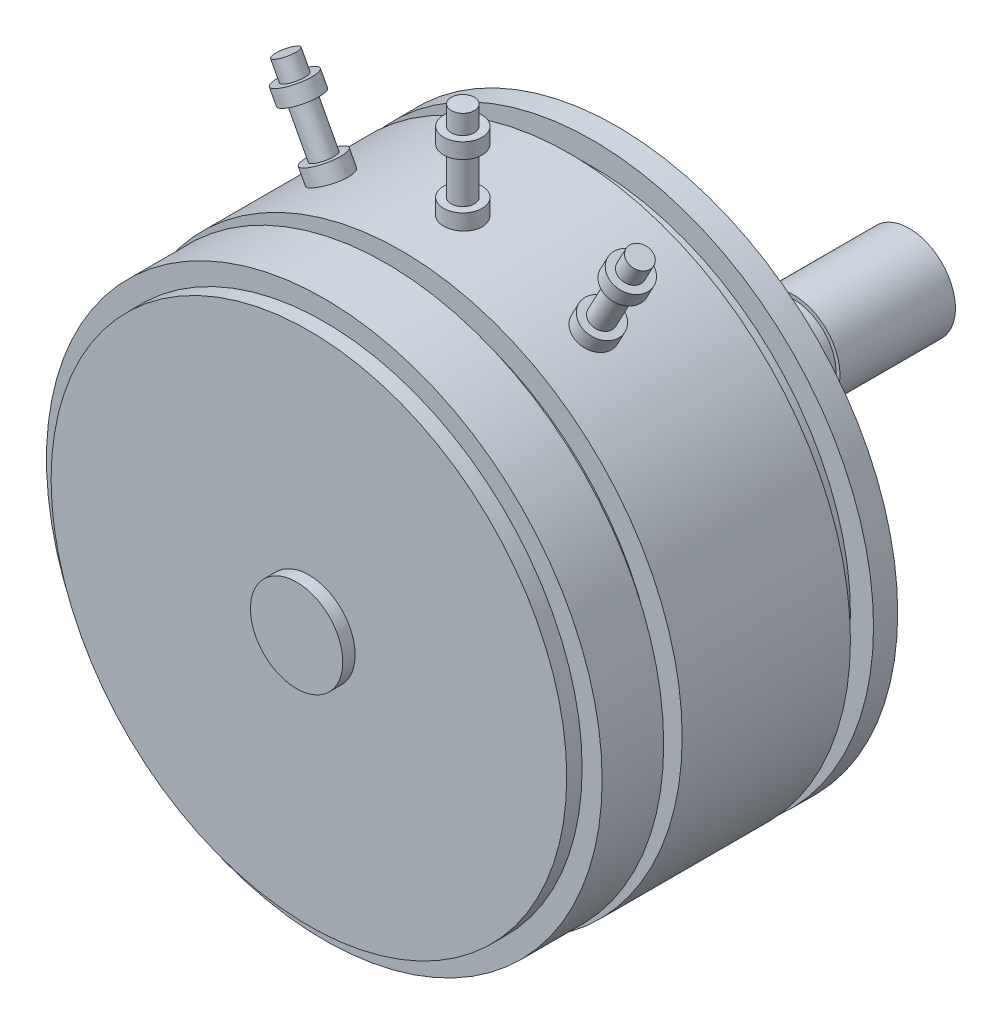
from build123d import *

# Parameters (mm, degrees)
SKETCH_5_R                 = 3
SKETCH_5_R_2               = 2.75
EXTRUDE_3_DEPTH            = 19
SKETCH_5_3_R               = 10
SKETCH_5_3_R_2             = 3
EXTRUDE_4_DEPTH            = 1.6
CUT_EXTRUDE_START          = 6.5
SKETCH_5_4_R               = 3
SKETCH_5_4_R_2             = 2.75
CUT_EXTRUDE_5_DEPTH        = 5
SKETCH_6_R                 = 0.75
EXTRUDE_5_DEPTH            = 24.5
EXTRUDE_START              = 18.207141
SKETCH_6_4_R               = 1.25
SKETCH_6_4_R_2             = 0.75
EXTRUDE_10_DEPTH           = 5.042859
SKETCH_6_5_R               = 1.25
SKETCH_6_5_R_2             = 0.75
CUT_EXTRUDE_6_DEPTH        = 22.25
SKETCH_6_6_R               = 1.25
SKETCH_6_6_R_2             = 0.75
EXTRUDE_11_DEPTH           = 19.25
PATTERN_CIRCULAR_1_ANGLE   = 28
PATTERN_CIRCULAR_1_2_ANGLE = 28
SKETCH_7_R                 = 1.5
CUT_EXTRUDE_7_DEPTH        = 3
EXTRUDE_START_2            = 0.8
SKETCH_8_R                 = 3
EXTRUDE_12_DEPTH           = 0.8


with BuildPart() as part:
    # 草图4 → 旋转1 (revolve)
    with BuildSketch(Plane(origin=(0, 0, 0), x_dir=(0, 0, -1), z_dir=(1, 0, 0)), mode=Mode.PRIVATE) as revolve_1_sk:
        Polygon((0, 0), (0, 16.75), (1, 16.75), (1, 18.05), (5, 18.05), (5, 16.75), (6, 16.75), (6, 18.25), (16.93, 18.25), (16.93, 16.75), (18.43, 16.75), (18.43, 18.25), (20, 18.25), (20, 0), align=None)
    revolve(revolve_1_sk.sketch.rotate(Axis((0, 0, 42.478286457), (0, 0, -1)), 90), axis=Axis((0, 0, 42.478286457), (0, 0, -1)))

    # 草图5 → 凸台-拉伸3 (add)
    # profile 1 of 2: a face of its own
    with BuildSketch(Plane(origin=(0, 0, -20), x_dir=(-1, 0, 0), z_dir=(0, 0, -1))):
        Circle(SKETCH_5_R)
        Circle(SKETCH_5_R_2, mode=Mode.SUBTRACT)
    # profile 2 of 2: a face of its own
    with BuildSketch(Plane(origin=(0, 0, -20), x_dir=(-1, 0, 0), z_dir=(0, 0, -1))):
        Circle(SKETCH_5_R_2)
    extrude(amount=EXTRUDE_3_DEPTH)

    # 草图5<3> → 凸台-拉伸4 (add)
    with BuildSketch(Plane(origin=(0, 0, -20), x_dir=(-1, 0, 0), z_dir=(0, 0, -1))):
        Circle(SKETCH_5_3_R)
        Circle(SKETCH_5_3_R_2, mode=Mode.SUBTRACT)
    extrude(amount=EXTRUDE_4_DEPTH)

    # 草图5<4> → 切除-拉伸5 (cut)
    with BuildSketch(Plane(origin=(0, 0, -20), x_dir=(-1, 0, 0), z_dir=(0, 0, -1)).offset(CUT_EXTRUDE_START)):
        Circle(SKETCH_5_4_R)
        Circle(SKETCH_5_4_R_2, mode=Mode.SUBTRACT)
    extrude(amount=CUT_EXTRUDE_5_DEPTH, mode=Mode.SUBTRACT)

    # 草图6 → 凸台-拉伸5 (add)
    with BuildSketch(Plane(origin=(0, 0, 0), x_dir=(1, 0, 0), z_dir=(0, 1, 0))):
        with Locations(Location((0, 10, 0), (0, 0, 90))):
            Circle(SKETCH_6_R)
    extrude(amount=EXTRUDE_5_DEPTH)

    # 草图6<4> → 凸台-拉伸10 (add)
    with BuildSketch(Plane(origin=(0, 0, 0), x_dir=(1, 0, 0), z_dir=(0, 1, 0)).offset(EXTRUDE_START)):
        with Locations(Location((0, 10, 0), (0, 0, 90))):
            Circle(SKETCH_6_4_R)
        with Locations(Location((0, 10, 0), (0, 0, 270))):
            Circle(SKETCH_6_4_R_2, mode=Mode.SUBTRACT)
    extrude(amount=EXTRUDE_10_DEPTH)

    # 草图6<5> → 切除-拉伸6 (cut)
    with BuildSketch(Plane(origin=(0, 0, 0), x_dir=(1, 0, 0), z_dir=(0, 1, 0))):
        with Locations(Location((0, 10, 0), (0, 0, 90))):
            Circle(SKETCH_6_5_R)
        with Locations(Location((0, 10, 0), (0, 0, 270))):
            Circle(SKETCH_6_5_R_2, mode=Mode.SUBTRACT)
    extrude(amount=CUT_EXTRUDE_6_DEPTH, mode=Mode.SUBTRACT)

    # 草图6<6> → 凸台-拉伸11 (add)
    with BuildSketch(Plane(origin=(0, 0, 0), x_dir=(1, 0, 0), z_dir=(0, 1, 0))):
        with Locations(Location((0, 10, 0), (0, 0, 90))):
            Circle(SKETCH_6_6_R)
        with Locations(Location((0, 10, 0), (0, 0, 270))):
            Circle(SKETCH_6_6_R_2, mode=Mode.SUBTRACT)
    extrude(amount=EXTRUDE_11_DEPTH)


with BuildPart() as body_2:
    # 阵列(圆周)1: read off the stored shape, not the designer's step
    # 阵列(圆周)1: copy of part
    add(part.part.rotate(Axis((0, 0, 0), (0, 0, -1)), PATTERN_CIRCULAR_1_ANGLE))


with BuildPart() as body_3:
    # Pattern Circular 1 2: copy of part
    add(part.part.rotate(Axis((0, 0, 0), (0, 0, 1)), PATTERN_CIRCULAR_1_2_ANGLE))


with BuildPart() as cut_extrude_7_tool:
    # 草图7 → 切除-拉伸7 (new body)
    with BuildSketch(Plane(origin=(0, 0, -20), x_dir=(-1, 0, 0), z_dir=(0, 0, -1))):
        with Locations((0, 15)):
            Circle(SKETCH_7_R)
        with Locations(Location((0, -15, 0), (0, 0, 180))):
            Circle(SKETCH_7_R)
        with Locations(Location((-12.990381057, 7.5, 0), (0, 0, 180))):
            Circle(SKETCH_7_R)
        with Locations(Location((12.990381057, 7.5, 0), (0, 0, 180))):
            Circle(SKETCH_7_R)
    extrude(amount=-CUT_EXTRUDE_7_DEPTH)


with BuildPart() as part_1:
    add(part.part)

    # 切除-拉伸7: cut by cut_extrude_7_tool
    add(cut_extrude_7_tool.part, mode=Mode.SUBTRACT)



with BuildPart() as body_2_1:
    add(body_2.part)

    # 切除-拉伸7: cut by cut_extrude_7_tool
    add(cut_extrude_7_tool.part, mode=Mode.SUBTRACT)


with BuildPart() as body_3_1:
    add(body_3.part)

    # 切除-拉伸7: cut by cut_extrude_7_tool
    add(cut_extrude_7_tool.part, mode=Mode.SUBTRACT)


with BuildPart() as part_2:
    add(part_1.part)

    add(body_2_1.part)  # 凸台-拉伸12 merges body 2

    add(body_3_1.part)  # 凸台-拉伸12 merges body 3
    # 草图8 → 凸台-拉伸12 (add)
    with BuildSketch(Plane.XY.offset(EXTRUDE_START_2)):
        with Locations(Location((0, 0, 0), (0, 0, 180))):
            Circle(SKETCH_8_R)
    extrude(amount=-EXTRUDE_12_DEPTH)


solid = part_2.part
